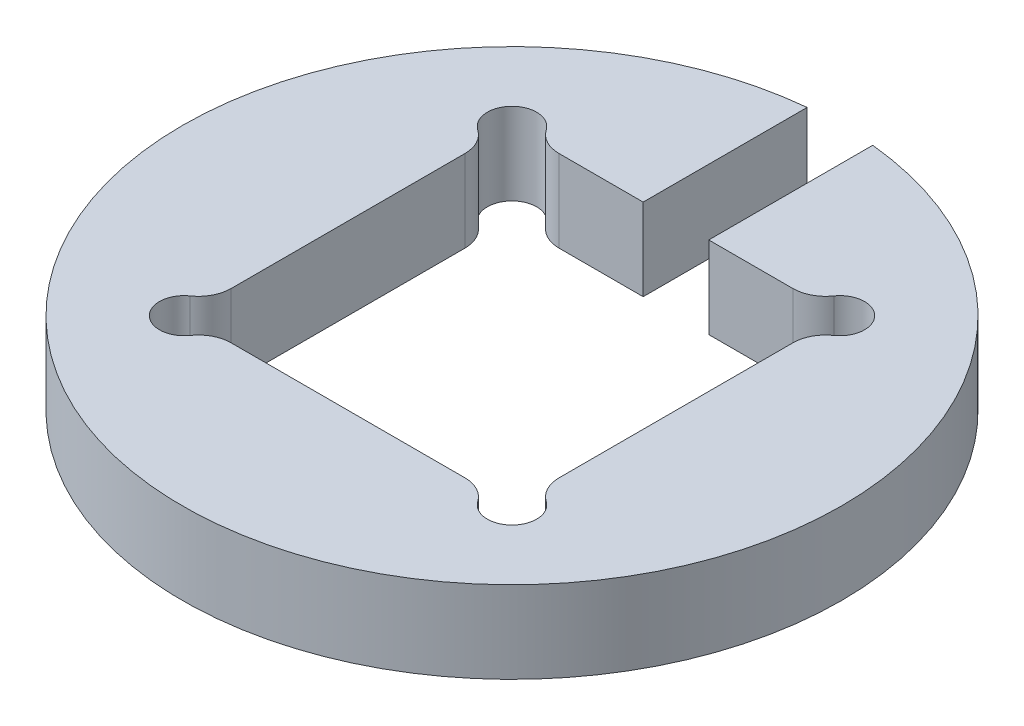
from build123d import *

# Parameters (mm, degrees)
BOSS_EXTRUDE1_DEPTH = 5
FILLET1_R           = 2


with BuildPart() as part:
    # Sketch1 → Boss-Extrude1 (new body)
    with BuildSketch(Plane(origin=(0, 0, 0), x_dir=(1, 0, 0), z_dir=(0, 1, 0))):
        with BuildLine():
            ThreePointArc((1.5, 0), (-1.060660172, -1.060660172), (0, 1.5))
            Line((0, 1.5), (0, 18.5))
            ThreePointArc((0, 18.5), (-1.060660172, 21.060660172), (1.5, 20))
            Line((1.5, 20), (8, 20))
            Line((8, 20), (8, 30))
            ThreePointArc((8, 30), (10, -10.099751242), (12, 30))
            Line((12, 30), (12, 20))
            Line((12, 20), (18.5, 20))
            ThreePointArc((18.5, 20), (21.060660172, 21.060660172), (20, 18.5))
            Line((20, 18.5), (20, 1.5))
            ThreePointArc((20, 1.5), (21.060660172, -1.060660172), (18.5, 0))
            Line((18.5, 0), (1.5, 0))
        make_face()
    extrude(amount=BOSS_EXTRUDE1_DEPTH)

    # Fillet1
    fillet1_edges = [part.edges().sort_by_distance(p)[0] for p in [
        (18.5, 2.5, 0),
        (20, 2.5, -1.5),
        (20, 2.5, -18.5),
        (0, 2.5, -1.5),
        (1.5, 2.5, 0),
        (0, 2.5, -18.5),
        (18.5, 2.5, -20),
        (1.5, 2.5, -20),
    ]]
    fillet(fillet1_edges, radius=FILLET1_R)


solid = part.part
